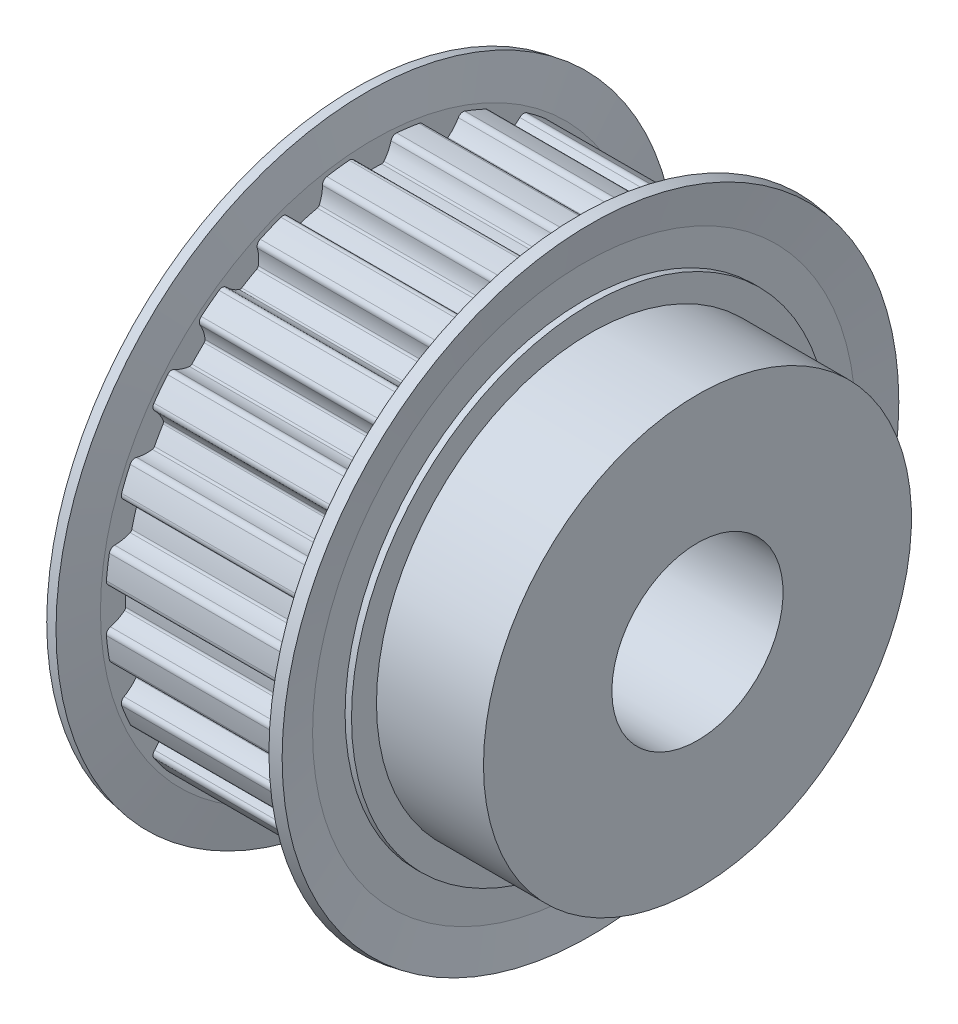
from build123d import *

# Parameters (mm, degrees)
CUT_EXTRUDE1_DEPTH = 28
CIRPATTERN1_START  = 2.5
CIRPATTERN1_DEPTH  = 28


# Read off the part's stored shape, not the designer's step: CirPattern1
with BuildPart() as part:
    # Sketch1 → Revolve1 (revolve)
    with BuildSketch(Plane.XY, mode=Mode.PRIVATE) as revolve1_sk:
        Polygon((0, 21), (0, 33.5), (2.5, 33.5), (2.5, 37.51), (30.5, 37.51), (30.5, 33.5), (33, 33.5), (33, 30), (48, 30), (48, 12), (24, 12), (24, 21), align=None)
    revolve(revolve1_sk.sketch.rotate(Axis((-6.060861443, 0, 0), (1, 0, 0)), 90), axis=Axis((-6.060861443, 0, 0), (1, 0, 0)))

    # Sketch2 → Cut-Extrude1 (cut)
    with BuildSketch(Plane(origin=(30.5, 0, 0), x_dir=(0, 0, -1), z_dir=(1, 0, 0))):
        with BuildLine():
            ThreePointArc((3.329839853, 37.3619093), (0, 37.51), (-3.329839853, 37.3619093))
            ThreePointArc((-3.329839853, 37.3619093), (-2.829683346, 37.226843023), (-2.536410296, 36.799771192))
            ThreePointArc((-2.536410296, 36.799771192), (-2.148487786, 35.752287649), (-1.549646265, 34.809369583))
            ThreePointArc((-1.549646265, 34.809369583), (-1.403966543, 34.694962266), (-1.222366607, 34.658450916))
            ThreePointArc((-1.222366607, 34.658450916), (0, 34.68), (1.222366607, 34.658450916))
            ThreePointArc((1.222366607, 34.658450916), (1.403966543, 34.694962266), (1.549646265, 34.809369583))
            ThreePointArc((1.549646265, 34.809369583), (2.148487786, 35.752287649), (2.536410296, 36.799771192))
            ThreePointArc((2.536410296, 36.799771192), (2.829683346, 37.226843023), (3.329839853, 37.3619093))
        make_face()
    extrude(amount=-CUT_EXTRUDE1_DEPTH, mode=Mode.SUBTRACT)

    # CirPattern1 outline → CirPattern1 (cut)
    with BuildSketch(Plane.YZ.offset(CIRPATTERN1_START)):
        with BuildLine():
            ThreePointArc((36.950659083, 6.453595377), (36.231877744, 9.708302382), (35.227007141, 12.886351999))
            ThreePointArc((35.227007141, 12.886351999), (35.225993165, 12.368280187), (34.889378105, 11.974465851))
            ThreePointArc((34.889378105, 11.974465851), (33.977988432, 11.32865279), (33.22219111, 10.506171145))
            ThreePointArc((33.22219111, 10.506171145), (33.149386815, 10.335844547), (33.161121081, 10.150982646))
            ThreePointArc((33.161121081, 10.150982646), (33.498307656, 8.975844484), (33.793864597, 7.789551696))
            ThreePointArc((33.793864597, 7.789551696), (33.876133375, 7.62358946), (34.024347043, 7.512484447))
            ThreePointArc((34.024347043, 7.512484447), (35.090127546, 7.178093109), (36.202320687, 7.074497429))
            ThreePointArc((36.202320687, 7.074497429), (36.690745048, 6.901751739), (36.950659083, 6.453595377))
        make_face()
        with BuildLine():
            ThreePointArc((34.021282514, 15.797228747), (32.484612896, 18.755), (30.691442661, 21.564680553))
            ThreePointArc((30.691442661, 21.564680553), (30.824550087, 21.063999174), (30.601331558, 20.596481347))
            ThreePointArc((30.601331558, 20.596481347), (29.888145454, 19.736788827), (29.370975216, 18.746717823))
            ThreePointArc((29.370975216, 18.746717823), (29.344735434, 18.563351825), (29.403915645, 18.387825992))
            ThreePointArc((29.403915645, 18.387825992), (30.033761003, 17.34), (30.626282252, 16.270624924))
            ThreePointArc((30.626282252, 16.270624924), (30.748701977, 16.131610441), (30.920621481, 16.062651759))
            ThreePointArc((30.920621481, 16.062651759), (32.036633241, 16.015498822), (33.137741854, 16.203289845))
            ThreePointArc((33.137741854, 16.203289845), (33.654233433, 16.162843849), (34.021282514, 15.797228747))
        make_face()
        with BuildLine():
            ThreePointArc((28.773411764, 24.064307084), (26.523575362, 26.523575362), (24.064307084, 28.773411764))
            ThreePointArc((24.064307084, 28.773411764), (24.322464861, 28.324241426), (24.227854836, 27.814880677))
            ThreePointArc((24.227854836, 27.814880677), (23.761474757, 26.799895323), (23.518175899, 25.709706663))
            ThreePointArc((23.518175899, 25.709706663), (23.540288828, 25.525797354), (23.642881951, 25.371569385))
            ThreePointArc((23.642881951, 25.371569385), (24.522463172, 24.522463172), (25.371569385, 23.642881951))
            ThreePointArc((25.371569385, 23.642881951), (25.525797354, 23.540288828), (25.709706663, 23.518175899))
            ThreePointArc((25.709706663, 23.518175899), (26.799895323, 23.761474757), (27.814880677, 24.227854836))
            ThreePointArc((27.814880677, 24.227854836), (28.324241426, 24.322464861), (28.773411764, 24.064307084))
        make_face()
        with BuildLine():
            ThreePointArc((21.564680553, 30.691442661), (18.755, 32.484612896), (15.797228747, 34.021282514))
            ThreePointArc((15.797228747, 34.021282514), (16.162843849, 33.654233433), (16.203289845, 33.137741854))
            ThreePointArc((16.203289845, 33.137741854), (16.015498822, 32.036633241), (16.062651759, 30.920621481))
            ThreePointArc((16.062651759, 30.920621481), (16.131610441, 30.748701977), (16.270624924, 30.626282252))
            ThreePointArc((16.270624924, 30.626282252), (17.34, 30.033761003), (18.387825992, 29.403915645))
            ThreePointArc((18.387825992, 29.403915645), (18.563351825, 29.344735434), (18.746717823, 29.370975216))
            ThreePointArc((18.746717823, 29.370975216), (19.736788827, 29.888145454), (20.596481347, 30.601331558))
            ThreePointArc((20.596481347, 30.601331558), (21.063999174, 30.824550087), (21.564680553, 30.691442661))
        make_face()
        with BuildLine():
            ThreePointArc((12.886351999, 35.227007141), (9.708302382, 36.231877744), (6.453595377, 36.950659083))
            ThreePointArc((6.453595377, 36.950659083), (6.901751739, 36.690745048), (7.074497429, 36.202320687))
            ThreePointArc((7.074497429, 36.202320687), (7.178093109, 35.090127546), (7.512484447, 34.024347043))
            ThreePointArc((7.512484447, 34.024347043), (7.62358946, 33.876133375), (7.789551696, 33.793864597))
            ThreePointArc((7.789551696, 33.793864597), (8.975844484, 33.498307656), (10.150982646, 33.161121081))
            ThreePointArc((10.150982646, 33.161121081), (10.335844547, 33.149386815), (10.506171145, 33.22219111))
            ThreePointArc((10.506171145, 33.22219111), (11.32865279, 33.977988432), (11.974465851, 34.889378105))
            ThreePointArc((11.974465851, 34.889378105), (12.368280187, 35.225993165), (12.886351999, 35.227007141))
        make_face()
        with BuildLine():
            ThreePointArc((3.329839853, 37.3619093), (0, 37.51), (-3.329839853, 37.3619093))
            ThreePointArc((-3.329839853, 37.3619093), (-2.829683346, 37.226843023), (-2.536410296, 36.799771192))
            ThreePointArc((-2.536410296, 36.799771192), (-2.148487786, 35.752287649), (-1.549646265, 34.809369583))
            ThreePointArc((-1.549646265, 34.809369583), (-1.403966543, 34.694962266), (-1.222366607, 34.658450916))
            ThreePointArc((-1.222366607, 34.658450916), (0, 34.68), (1.222366607, 34.658450916))
            ThreePointArc((1.222366607, 34.658450916), (1.403966543, 34.694962266), (1.549646265, 34.809369583))
            ThreePointArc((1.549646265, 34.809369583), (2.148487786, 35.752287649), (2.536410296, 36.799771192))
            ThreePointArc((2.536410296, 36.799771192), (2.829683346, 37.226843023), (3.329839853, 37.3619093))
        make_face()
        with BuildLine():
            ThreePointArc((-6.453595377, 36.950659084), (-9.708302382, 36.231877744), (-12.886351999, 35.227007142))
            ThreePointArc((-12.886351999, 35.227007142), (-12.368280187, 35.225993165), (-11.974465851, 34.889378105))
            ThreePointArc((-11.974465851, 34.889378105), (-11.32865279, 33.977988432), (-10.506171145, 33.22219111))
            ThreePointArc((-10.506171145, 33.22219111), (-10.335844547, 33.149386815), (-10.150982646, 33.161121081))
            ThreePointArc((-10.150982646, 33.161121081), (-8.975844484, 33.498307656), (-7.789551696, 33.793864597))
            ThreePointArc((-7.789551696, 33.793864597), (-7.62358946, 33.876133375), (-7.512484447, 34.024347043))
            ThreePointArc((-7.512484447, 34.024347043), (-7.178093109, 35.090127546), (-7.074497429, 36.202320687))
            ThreePointArc((-7.074497429, 36.202320687), (-6.901751739, 36.690745048), (-6.453595377, 36.950659084))
        make_face()
        with BuildLine():
            ThreePointArc((-15.797228747, 34.021282514), (-18.755, 32.484612896), (-21.564680553, 30.691442661))
            ThreePointArc((-21.564680553, 30.691442661), (-21.063999174, 30.824550087), (-20.596481347, 30.601331558))
            ThreePointArc((-20.596481347, 30.601331558), (-19.736788827, 29.888145454), (-18.746717823, 29.370975216))
            ThreePointArc((-18.746717823, 29.370975216), (-18.563351825, 29.344735434), (-18.387825992, 29.403915645))
            ThreePointArc((-18.387825992, 29.403915645), (-17.34, 30.033761003), (-16.270624924, 30.626282252))
            ThreePointArc((-16.270624924, 30.626282252), (-16.131610441, 30.748701977), (-16.062651759, 30.920621481))
            ThreePointArc((-16.062651759, 30.920621481), (-16.015498822, 32.036633241), (-16.203289845, 33.137741854))
            ThreePointArc((-16.203289845, 33.137741854), (-16.162843849, 33.654233433), (-15.797228747, 34.021282514))
        make_face()
        with BuildLine():
            ThreePointArc((-24.064307084, 28.773411764), (-26.523575362, 26.523575362), (-28.773411764, 24.064307084))
            ThreePointArc((-28.773411764, 24.064307084), (-28.324241426, 24.322464861), (-27.814880677, 24.227854836))
            ThreePointArc((-27.814880677, 24.227854836), (-26.799895323, 23.761474757), (-25.709706663, 23.518175899))
            ThreePointArc((-25.709706663, 23.518175899), (-25.525797354, 23.540288828), (-25.371569385, 23.642881951))
            ThreePointArc((-25.371569385, 23.642881951), (-24.522463172, 24.522463172), (-23.642881951, 25.371569385))
            ThreePointArc((-23.642881951, 25.371569385), (-23.540288828, 25.525797354), (-23.518175899, 25.709706663))
            ThreePointArc((-23.518175899, 25.709706663), (-23.761474757, 26.799895323), (-24.227854836, 27.814880677))
            ThreePointArc((-24.227854836, 27.814880677), (-24.322464861, 28.324241426), (-24.064307084, 28.773411764))
        make_face()
        with BuildLine():
            ThreePointArc((-30.691442661, 21.564680553), (-32.484612896, 18.755), (-34.021282514, 15.797228747))
            ThreePointArc((-34.021282514, 15.797228747), (-33.654233433, 16.162843849), (-33.137741854, 16.203289845))
            ThreePointArc((-33.137741854, 16.203289845), (-32.036633241, 16.015498822), (-30.920621481, 16.062651759))
            ThreePointArc((-30.920621481, 16.062651759), (-30.748701977, 16.131610441), (-30.626282252, 16.270624924))
            ThreePointArc((-30.626282252, 16.270624924), (-30.033761003, 17.34), (-29.403915645, 18.387825992))
            ThreePointArc((-29.403915645, 18.387825992), (-29.344735434, 18.563351825), (-29.370975216, 18.746717823))
            ThreePointArc((-29.370975216, 18.746717823), (-29.888145454, 19.736788827), (-30.601331558, 20.596481347))
            ThreePointArc((-30.601331558, 20.596481347), (-30.824550087, 21.063999174), (-30.691442661, 21.564680553))
        make_face()
        with BuildLine():
            ThreePointArc((-35.227007142, 12.886351999), (-36.231877744, 9.708302382), (-36.950659084, 6.453595377))
            ThreePointArc((-36.950659084, 6.453595377), (-36.690745048, 6.901751739), (-36.202320687, 7.074497429))
            ThreePointArc((-36.202320687, 7.074497429), (-35.090127546, 7.178093109), (-34.024347043, 7.512484447))
            ThreePointArc((-34.024347043, 7.512484447), (-33.876133375, 7.62358946), (-33.793864597, 7.789551696))
            ThreePointArc((-33.793864597, 7.789551696), (-33.498307656, 8.975844484), (-33.161121081, 10.150982646))
            ThreePointArc((-33.161121081, 10.150982646), (-33.149386815, 10.335844547), (-33.22219111, 10.506171145))
            ThreePointArc((-33.22219111, 10.506171145), (-33.977988432, 11.32865279), (-34.889378105, 11.974465851))
            ThreePointArc((-34.889378105, 11.974465851), (-35.225993165, 12.368280187), (-35.227007142, 12.886351999))
        make_face()
        with BuildLine():
            ThreePointArc((-37.3619093, 3.329839853), (-37.51, 0), (-37.3619093, -3.329839853))
            ThreePointArc((-37.3619093, -3.329839853), (-37.226843023, -2.829683346), (-36.799771192, -2.536410296))
            ThreePointArc((-36.799771192, -2.536410296), (-35.752287649, -2.148487786), (-34.809369583, -1.549646265))
            ThreePointArc((-34.809369583, -1.549646265), (-34.694962266, -1.403966543), (-34.658450916, -1.222366607))
            ThreePointArc((-34.658450916, -1.222366607), (-34.68, 0), (-34.658450916, 1.222366607))
            ThreePointArc((-34.658450916, 1.222366607), (-34.694962266, 1.403966543), (-34.809369583, 1.549646265))
            ThreePointArc((-34.809369583, 1.549646265), (-35.752287649, 2.148487786), (-36.799771192, 2.536410296))
            ThreePointArc((-36.799771192, 2.536410296), (-37.226843023, 2.829683346), (-37.3619093, 3.329839853))
        make_face()
        with BuildLine():
            ThreePointArc((-36.950659084, -6.453595377), (-36.231877744, -9.708302382), (-35.227007142, -12.886351999))
            ThreePointArc((-35.227007142, -12.886351999), (-35.225993165, -12.368280187), (-34.889378105, -11.974465851))
            ThreePointArc((-34.889378105, -11.974465851), (-33.977988432, -11.32865279), (-33.22219111, -10.506171145))
            ThreePointArc((-33.22219111, -10.506171145), (-33.149386815, -10.335844547), (-33.161121081, -10.150982646))
            ThreePointArc((-33.161121081, -10.150982646), (-33.498307656, -8.975844484), (-33.793864597, -7.789551696))
            ThreePointArc((-33.793864597, -7.789551696), (-33.876133375, -7.62358946), (-34.024347043, -7.512484447))
            ThreePointArc((-34.024347043, -7.512484447), (-35.090127546, -7.178093109), (-36.202320687, -7.074497429))
            ThreePointArc((-36.202320687, -7.074497429), (-36.690745048, -6.901751739), (-36.950659084, -6.453595377))
        make_face()
        with BuildLine():
            ThreePointArc((-34.021282514, -15.797228747), (-32.484612896, -18.755), (-30.691442661, -21.564680553))
            ThreePointArc((-30.691442661, -21.564680553), (-30.824550087, -21.063999174), (-30.601331558, -20.596481347))
            ThreePointArc((-30.601331558, -20.596481347), (-29.888145454, -19.736788827), (-29.370975216, -18.746717823))
            ThreePointArc((-29.370975216, -18.746717823), (-29.344735434, -18.563351825), (-29.403915645, -18.387825992))
            ThreePointArc((-29.403915645, -18.387825992), (-30.033761003, -17.34), (-30.626282252, -16.270624924))
            ThreePointArc((-30.626282252, -16.270624924), (-30.748701977, -16.131610441), (-30.920621481, -16.062651759))
            ThreePointArc((-30.920621481, -16.062651759), (-32.036633241, -16.015498822), (-33.137741854, -16.203289845))
            ThreePointArc((-33.137741854, -16.203289845), (-33.654233433, -16.162843849), (-34.021282514, -15.797228747))
        make_face()
        with BuildLine():
            ThreePointArc((-28.773411764, -24.064307084), (-26.523575362, -26.523575362), (-24.064307084, -28.773411764))
            ThreePointArc((-24.064307084, -28.773411764), (-24.322464861, -28.324241426), (-24.227854836, -27.814880677))
            ThreePointArc((-24.227854836, -27.814880677), (-23.761474757, -26.799895323), (-23.518175899, -25.709706663))
            ThreePointArc((-23.518175899, -25.709706663), (-23.540288828, -25.525797354), (-23.642881951, -25.371569385))
            ThreePointArc((-23.642881951, -25.371569385), (-24.522463172, -24.522463172), (-25.371569385, -23.642881951))
            ThreePointArc((-25.371569385, -23.642881951), (-25.525797354, -23.540288828), (-25.709706663, -23.518175899))
            ThreePointArc((-25.709706663, -23.518175899), (-26.799895323, -23.761474757), (-27.814880677, -24.227854836))
            ThreePointArc((-27.814880677, -24.227854836), (-28.324241426, -24.322464861), (-28.773411764, -24.064307084))
        make_face()
        with BuildLine():
            ThreePointArc((-21.564680553, -30.691442661), (-18.755, -32.484612896), (-15.797228747, -34.021282514))
            ThreePointArc((-15.797228747, -34.021282514), (-16.162843849, -33.654233433), (-16.203289845, -33.137741854))
            ThreePointArc((-16.203289845, -33.137741854), (-16.015498822, -32.036633241), (-16.062651759, -30.920621481))
            ThreePointArc((-16.062651759, -30.920621481), (-16.131610441, -30.748701977), (-16.270624924, -30.626282252))
            ThreePointArc((-16.270624924, -30.626282252), (-17.34, -30.033761003), (-18.387825992, -29.403915645))
            ThreePointArc((-18.387825992, -29.403915645), (-18.563351825, -29.344735434), (-18.746717823, -29.370975216))
            ThreePointArc((-18.746717823, -29.370975216), (-19.736788827, -29.888145454), (-20.596481347, -30.601331558))
            ThreePointArc((-20.596481347, -30.601331558), (-21.063999174, -30.824550087), (-21.564680553, -30.691442661))
        make_face()
        with BuildLine():
            ThreePointArc((-12.886351999, -35.227007142), (-9.708302382, -36.231877744), (-6.453595377, -36.950659084))
            ThreePointArc((-6.453595377, -36.950659084), (-6.901751739, -36.690745048), (-7.074497429, -36.202320687))
            ThreePointArc((-7.074497429, -36.202320687), (-7.178093109, -35.090127546), (-7.512484447, -34.024347043))
            ThreePointArc((-7.512484447, -34.024347043), (-7.62358946, -33.876133375), (-7.789551696, -33.793864597))
            ThreePointArc((-7.789551696, -33.793864597), (-8.975844484, -33.498307656), (-10.150982646, -33.161121081))
            ThreePointArc((-10.150982646, -33.161121081), (-10.335844547, -33.149386815), (-10.506171145, -33.22219111))
            ThreePointArc((-10.506171145, -33.22219111), (-11.32865279, -33.977988432), (-11.974465851, -34.889378105))
            ThreePointArc((-11.974465851, -34.889378105), (-12.368280187, -35.225993165), (-12.886351999, -35.227007142))
        make_face()
        with BuildLine():
            ThreePointArc((-3.329839853, -37.3619093), (0, -37.51), (3.329839853, -37.3619093))
            ThreePointArc((3.329839853, -37.3619093), (2.829683346, -37.226843023), (2.536410296, -36.799771192))
            ThreePointArc((2.536410296, -36.799771192), (2.148487786, -35.752287649), (1.549646265, -34.809369583))
            ThreePointArc((1.549646265, -34.809369583), (1.403966543, -34.694962266), (1.222366607, -34.658450916))
            ThreePointArc((1.222366607, -34.658450916), (0, -34.68), (-1.222366607, -34.658450916))
            ThreePointArc((-1.222366607, -34.658450916), (-1.403966543, -34.694962266), (-1.549646265, -34.809369583))
            ThreePointArc((-1.549646265, -34.809369583), (-2.148487786, -35.752287649), (-2.536410296, -36.799771192))
            ThreePointArc((-2.536410296, -36.799771192), (-2.829683346, -37.226843023), (-3.329839853, -37.3619093))
        make_face()
        with BuildLine():
            ThreePointArc((6.453595377, -36.950659083), (9.708302382, -36.231877744), (12.886351999, -35.227007141))
            ThreePointArc((12.886351999, -35.227007141), (12.368280187, -35.225993165), (11.974465851, -34.889378105))
            ThreePointArc((11.974465851, -34.889378105), (11.32865279, -33.977988432), (10.506171145, -33.22219111))
            ThreePointArc((10.506171145, -33.22219111), (10.335844547, -33.149386815), (10.150982646, -33.161121081))
            ThreePointArc((10.150982646, -33.161121081), (8.975844484, -33.498307656), (7.789551696, -33.793864597))
            ThreePointArc((7.789551696, -33.793864597), (7.62358946, -33.876133375), (7.512484447, -34.024347043))
            ThreePointArc((7.512484447, -34.024347043), (7.178093109, -35.090127546), (7.074497429, -36.202320687))
            ThreePointArc((7.074497429, -36.202320687), (6.901751739, -36.690745048), (6.453595377, -36.950659083))
        make_face()
        with BuildLine():
            ThreePointArc((15.797228747, -34.021282514), (18.755, -32.484612896), (21.564680553, -30.691442661))
            ThreePointArc((21.564680553, -30.691442661), (21.063999174, -30.824550087), (20.596481347, -30.601331558))
            ThreePointArc((20.596481347, -30.601331558), (19.736788827, -29.888145454), (18.746717823, -29.370975216))
            ThreePointArc((18.746717823, -29.370975216), (18.563351825, -29.344735434), (18.387825992, -29.403915645))
            ThreePointArc((18.387825992, -29.403915645), (17.34, -30.033761003), (16.270624924, -30.626282252))
            ThreePointArc((16.270624924, -30.626282252), (16.131610441, -30.748701977), (16.062651759, -30.920621481))
            ThreePointArc((16.062651759, -30.920621481), (16.015498822, -32.036633241), (16.203289845, -33.137741854))
            ThreePointArc((16.203289845, -33.137741854), (16.162843849, -33.654233433), (15.797228747, -34.021282514))
        make_face()
        with BuildLine():
            ThreePointArc((24.064307084, -28.773411764), (26.523575362, -26.523575362), (28.773411764, -24.064307084))
            ThreePointArc((28.773411764, -24.064307084), (28.324241426, -24.322464861), (27.814880677, -24.227854836))
            ThreePointArc((27.814880677, -24.227854836), (26.799895323, -23.761474757), (25.709706663, -23.518175899))
            ThreePointArc((25.709706663, -23.518175899), (25.525797354, -23.540288828), (25.371569385, -23.642881951))
            ThreePointArc((25.371569385, -23.642881951), (24.522463172, -24.522463172), (23.642881951, -25.371569385))
            ThreePointArc((23.642881951, -25.371569385), (23.540288828, -25.525797354), (23.518175899, -25.709706663))
            ThreePointArc((23.518175899, -25.709706663), (23.761474757, -26.799895323), (24.227854836, -27.814880677))
            ThreePointArc((24.227854836, -27.814880677), (24.322464861, -28.324241426), (24.064307084, -28.773411764))
        make_face()
        with BuildLine():
            ThreePointArc((30.691442661, -21.564680553), (32.484612896, -18.755), (34.021282514, -15.797228747))
            ThreePointArc((34.021282514, -15.797228747), (33.654233433, -16.162843849), (33.137741854, -16.203289845))
            ThreePointArc((33.137741854, -16.203289845), (32.036633241, -16.015498822), (30.920621481, -16.062651759))
            ThreePointArc((30.920621481, -16.062651759), (30.748701977, -16.131610441), (30.626282252, -16.270624924))
            ThreePointArc((30.626282252, -16.270624924), (30.033761003, -17.34), (29.403915645, -18.387825992))
            ThreePointArc((29.403915645, -18.387825992), (29.344735434, -18.563351825), (29.370975216, -18.746717823))
            ThreePointArc((29.370975216, -18.746717823), (29.888145454, -19.736788827), (30.601331558, -20.596481347))
            ThreePointArc((30.601331558, -20.596481347), (30.824550087, -21.063999174), (30.691442661, -21.564680553))
        make_face()
        with BuildLine():
            ThreePointArc((33.793864597, -7.789551696), (33.498307656, -8.975844484), (33.161121081, -10.150982646))
            ThreePointArc((33.161121081, -10.150982646), (33.149386815, -10.335844547), (33.22219111, -10.506171145))
            ThreePointArc((33.22219111, -10.506171145), (33.977988432, -11.32865279), (34.889378105, -11.974465851))
            ThreePointArc((34.889378105, -11.974465851), (35.225993165, -12.368280187), (35.227007141, -12.886351999))
            ThreePointArc((35.227007141, -12.886351999), (36.231877744, -9.708302382), (36.950659083, -6.453595377))
            ThreePointArc((36.950659083, -6.453595377), (36.690745048, -6.901751739), (36.202320687, -7.074497429))
            ThreePointArc((36.202320687, -7.074497429), (35.090127546, -7.178093109), (34.024347043, -7.512484447))
            ThreePointArc((34.024347043, -7.512484447), (33.876133375, -7.62358946), (33.793864597, -7.789551696))
        make_face()
    extrude(amount=CIRPATTERN1_DEPTH, mode=Mode.SUBTRACT)

    # Sketch3 → Revolve2 (revolve)
    with BuildSketch(Plane.XY, mode=Mode.PRIVATE) as revolve2_sk:
        Polygon((0.9, 33.5), (0.9, 38.056742574), (0, 43.225534538), (1.576283195, 43.5), (2.5, 38.195), (2.5, 33.5), align=None)
        Polygon((30.5, 33.5), (30.5, 38.195), (31.423716805, 43.5), (33, 43.225534538), (32.1, 38.056742574), (32.1, 33.5), align=None)
    revolve(revolve2_sk.sketch.rotate(Axis((-5.836851487, 0, 0), (1, 0, 0)), 90), axis=Axis((-5.836851487, 0, 0), (1, 0, 0)))


solid = part.part
